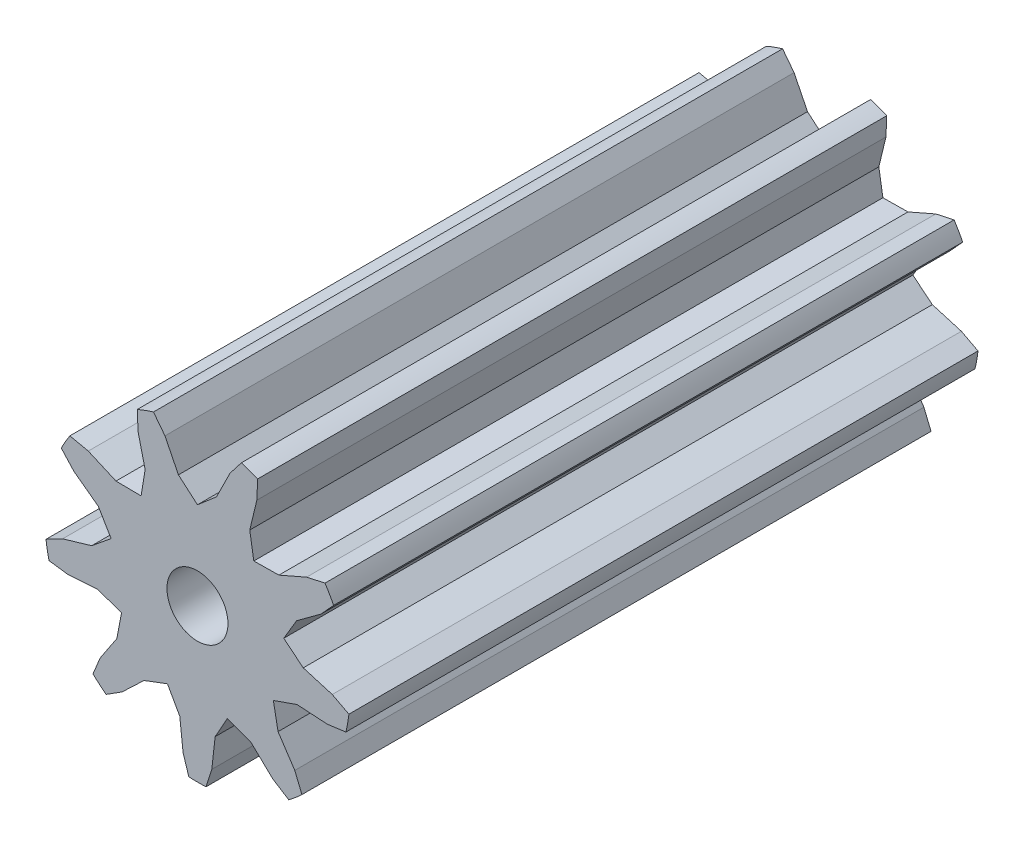
from build123d import *

# Parameters (mm, degrees)
SKETCH1_R               = 8
BOSS_EXTRUDE1_DEPTH     = 33
CUT_EXTRUDE1_DEPTH      = 35.885527085
CUT_EXTRUDE2_DEPTH      = 35.885527085
CUT_EXTRUDE2_DEPTH_BACK = 35.885527085
SKETCH4_R               = 1.6
CIRPATTERN1_COUNT       = 9


with BuildPart() as part:
    # Sketch1 → Boss-Extrude1 (new body)
    with BuildSketch(Plane.XY):
        Circle(SKETCH1_R)
    extrude(amount=BOSS_EXTRUDE1_DEPTH)

    # Sketch2 → Cut-Extrude1 (cut, through all)
    with BuildSketch(Plane.XY):
        Polygon((0, 4.598652342), (-0.998470792, 5.45807973), (-1.704297747, 6.879144667), (-2.306603416, 7.660259831), (-1.704297747, 8.443459349), (0, 9.157698868), (1.704297747, 8.443459349), (2.306603416, 7.660259831), (1.704297747, 6.879144667), (0.998470792, 5.45807973), align=None)
    cut_extrude1 = extrude(amount=CUT_EXTRUDE1_DEPTH, mode=Mode.SUBTRACT)

    # Sketch4 → Cut-Extrude2 (cut, two sides: drawn at the far end of the back side and taken through both)
    with BuildSketch(Plane.XY.offset(33).offset(-CUT_EXTRUDE2_DEPTH_BACK)):
        Circle(SKETCH4_R)
    extrude(amount=CUT_EXTRUDE2_DEPTH + CUT_EXTRUDE2_DEPTH_BACK, mode=Mode.SUBTRACT)

    # CirPattern1: Cut-Extrude1 ×9 about axis
    cirpattern1_axis = Axis((0, 0, 33), (0, 0, -1))
    for i in range(1, CIRPATTERN1_COUNT):
        add(cut_extrude1.rotate(cirpattern1_axis, i * 360 / CIRPATTERN1_COUNT), mode=Mode.SUBTRACT)


solid = part.part
